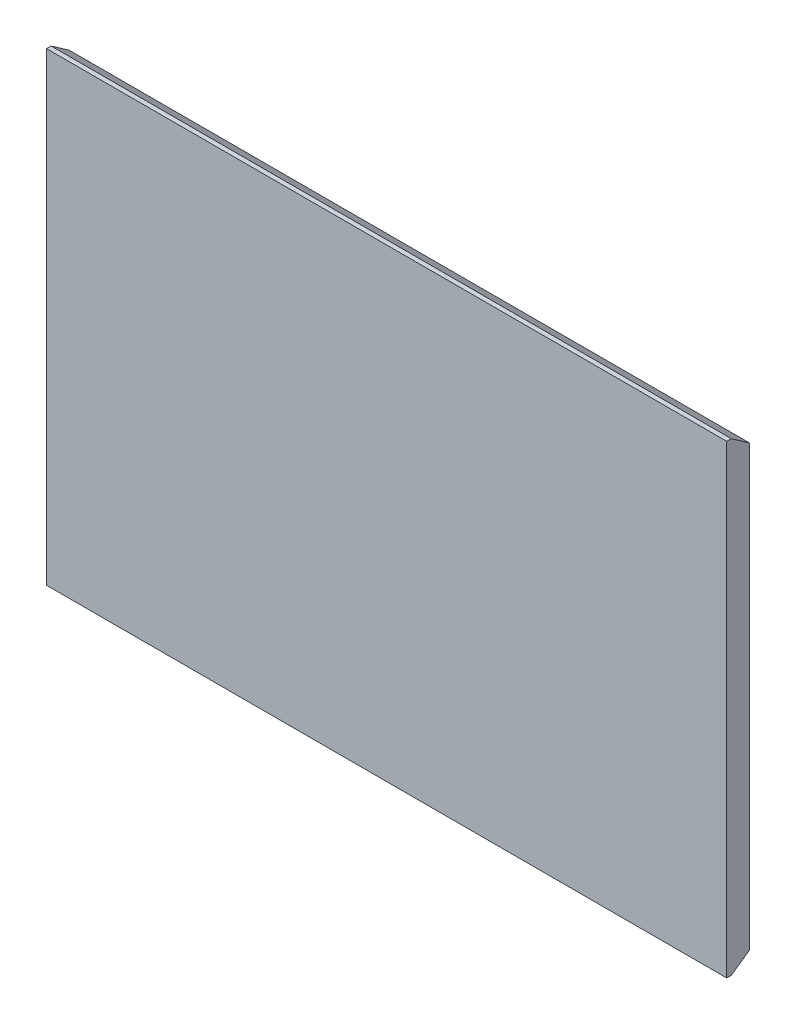
from build123d import *

# Parameters (mm, degrees)
SKETCH_1_W             = 300
SKETCH_1_H             = 205
SM_BASE_FLANGE_1_DEPTH = 10
CHAMFER_1_SIZE         = 8
CHAMFER_1_SIZE2        = 5.601660306
CHAMFER_2_SIZE         = 8
CHAMFER_2_SIZE2        = 5.601660306


# Sheet-metal steps are written as plain solids
with BuildPart() as part:
    # Sketch 1 → 基体-法兰1 (new body)
    with BuildSketch(Plane.XY):
        Rectangle(SKETCH_1_W, SKETCH_1_H)
    extrude(amount=-SM_BASE_FLANGE_1_DEPTH)

    # 倒角1
    chamfer_1_edges = [part.edges().sort_by_distance(p)[0] for p in [
        (0, 102.5, -10),
    ]]
    chamfer_1_side = [part.faces().sort_by_distance(p)[0] for p in [
        (0, 102.5, -5),
    ]]
    chamfer(chamfer_1_edges, length=CHAMFER_1_SIZE, length2=CHAMFER_1_SIZE2, reference=chamfer_1_side[0])

    # 倒角2
    chamfer_2_edges = [part.edges().sort_by_distance(p)[0] for p in [
        (0, -102.5, -10),
    ]]
    chamfer_2_side = [part.faces().sort_by_distance(p)[0] for p in [
        (0, -102.5, -5),
    ]]
    chamfer(chamfer_2_edges, length=CHAMFER_2_SIZE, length2=CHAMFER_2_SIZE2, reference=chamfer_2_side[0])


solid = part.part
